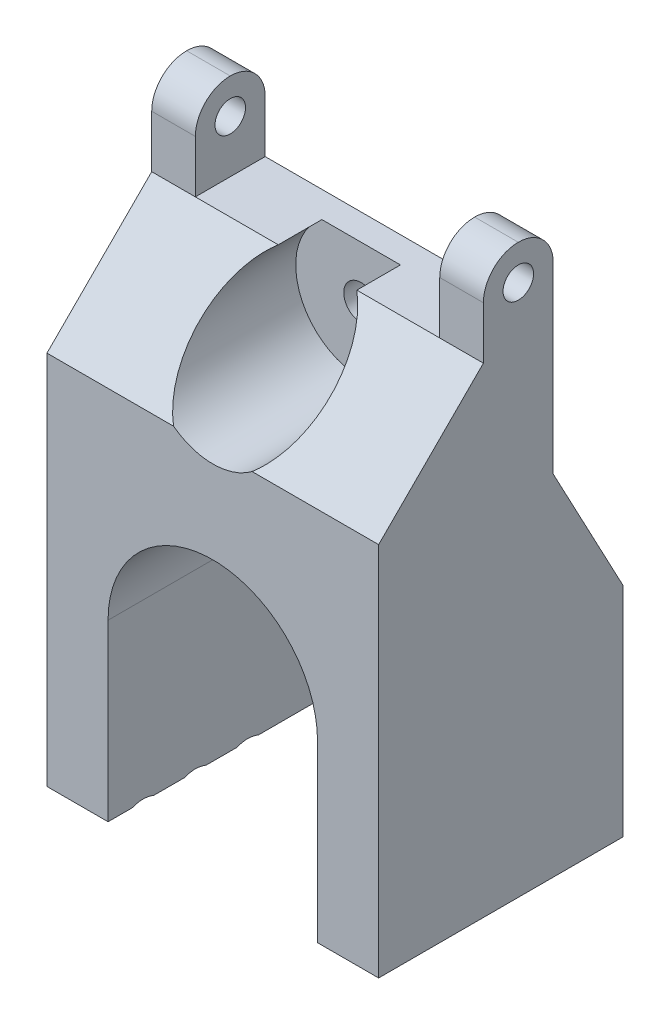
from build123d import *
from OCP.BRepFilletAPI import BRepFilletAPI_MakeChamfer

# Parameters (mm, degrees)
SKETCH1_W               = 38
SKETCH1_H               = 55
BOSS_EXTRUDE1_DEPTH     = 20
CUT_EXTRUDE1_DEPTH      = 39.951893407
SKETCH3_R               = 2.25
CUT_EXTRUDE2_DEPTH      = 20
LPATTERN1_COUNT         = 3
LPATTERN1_PITCH         = 6
CHAMFER1_SIZE           = 12
SKETCH4_W               = 5
SKETCH4_H               = 8
BOSS_EXTRUDE2_DEPTH     = 10
FILLET1_R               = 4
SKETCH5_R               = 1.75
CUT_EXTRUDE3_DEPTH      = 58.010963858
FILLET1_OF_MIRROR1_R    = 4
CHAMFER2_SIZE           = 1
SKETCH6_R               = 7.5
CUT_EXTRUDE4_DEPTH      = 17
CUT_EXTRUDE5_DEPTH      = 46.345892868
CUT_EXTRUDE5_DEPTH_BACK = 46.345892868
SKETCH7_R               = 2
SKETCH8_W               = 7
SKETCH8_H               = 40
BOSS_EXTRUDE3_DEPTH     = 8
CHAMFER3_SIZE           = 15.045811723
CHAMFER3_SIZE_2         = 8


# Some blends are built 0.0001 mm under size
with BuildPart() as part:
    # Sketch1 → Boss-Extrude1 (new body)
    with BuildSketch(Plane.XY):
        Rectangle(SKETCH1_W, SKETCH1_H)
    extrude(amount=BOSS_EXTRUDE1_DEPTH)

    # Sketch2 → Cut-Extrude1 (cut, through all)
    with BuildSketch(Plane.XY.offset(20)):
        with BuildLine():
            Line((-12, -27.5), (12, -27.5))
            Line((12, -27.5), (12, -7.5))
            ThreePointArc((12, -7.5), (0, 4.5), (-12, -7.5))
            Line((-12, -7.5), (-12, -27.5))
        make_face()
    extrude(amount=-CUT_EXTRUDE1_DEPTH, mode=Mode.SUBTRACT)

    # Sketch3 → Cut-Extrude2 (cut)
    with BuildSketch(Plane.XZ.offset(27.5)):
        with Locations(Location((-15, 16, 0), (0, 0, 270))):
            Circle(SKETCH3_R)
        with Locations(Location((15, 16, 0), (0, 0, 270))):
            Circle(SKETCH3_R)
    cut_extrude2 = extrude(amount=-CUT_EXTRUDE2_DEPTH, mode=Mode.SUBTRACT)

    # LPattern1: Cut-Extrude2 ×3
    with Locations(*[(0, 0, -i * LPATTERN1_PITCH) for i in range(1, LPATTERN1_COUNT)]):
        add(cut_extrude2, mode=Mode.SUBTRACT)

    # Chamfer1
    chamfer1_edges = [part.edges().sort_by_distance(p)[0] for p in [
        (0, 27.5, 20),
    ]]
    chamfer(chamfer1_edges, length=CHAMFER1_SIZE)

    # Sketch4 → Boss-Extrude2 (add)
    with BuildSketch(Plane(origin=(0, 27.5, 0), x_dir=(1, 0, 0), z_dir=(0, 1, 0))):
        with Locations((-16.5, -4)):
            Rectangle(SKETCH4_W, SKETCH4_H)
    boss_extrude2 = extrude(amount=BOSS_EXTRUDE2_DEPTH)

    # Fillet1
    fillet1_edges = [part.edges().sort_by_distance(p)[0] for p in [
        (-16.5, 37.5, 0),
        (-16.5, 37.5, 8),
    ]]
    fillet(fillet1_edges, radius=FILLET1_R - 0.0001)  # a hair under: the kernel refuses the full size

    # Sketch5 → Cut-Extrude3 (cut, through all)
    with BuildSketch(Plane.ZY.offset(19)):
        with Locations((4, 33.5)):
            Circle(SKETCH5_R)
    cut_extrude3 = extrude(amount=-CUT_EXTRUDE3_DEPTH, mode=Mode.SUBTRACT)

    # Mirror1: Boss-Extrude2, Cut-Extrude3 across plane
    add(boss_extrude2.mirror(Plane(origin=(0, 0, 0), x_dir=(0, 0, 1), z_dir=(1, 0, 0))))
    add(cut_extrude3.mirror(Plane(origin=(0, 0, 0), x_dir=(0, 0, 1), z_dir=(1, 0, 0))), mode=Mode.SUBTRACT)

    # Fillet1 of Mirror1
    fillet1_of_mirror1_edges = [part.edges().sort_by_distance(p)[0] for p in [
        (16.5, 37.5, 0),
        (16.5, 37.5, 8),
    ]]
    fillet(fillet1_of_mirror1_edges, radius=FILLET1_OF_MIRROR1_R - 0.0001)  # a hair under: the kernel refuses the full size

    # Chamfer2
    # the kernel refuses this chamfer: 1 mm, written as the material it takes off along each edge
    with BuildSketch(Plane(origin=(-15, -27.5, 16), x_dir=(0, 0, -1), z_dir=(-1, 0, 0))) as chamfer2_piece_1:
        Polygon((2.25 + CHAMFER2_SIZE, 0), (2.25, -CHAMFER2_SIZE), (2.25, 0), align=None)
    revolve(axis=Axis((-15, -27.5, 16), (0, -1, 0)), mode=Mode.SUBTRACT)
    with BuildSketch(Plane(origin=(15, -27.5, 16), x_dir=(0, 0, -1), z_dir=(-1, 0, 0))) as chamfer2_piece_2:
        Polygon((2.25 + CHAMFER2_SIZE, 0), (2.25, -CHAMFER2_SIZE), (2.25, 0), align=None)
    revolve(axis=Axis((15, -27.5, 16), (0, -1, 0)), mode=Mode.SUBTRACT)
    with BuildSketch(Plane(origin=(-15, -27.5, 10), x_dir=(0, 0, -1), z_dir=(-1, 0, 0))) as chamfer2_piece_3:
        Polygon((2.25 + CHAMFER2_SIZE, 0), (2.25, -CHAMFER2_SIZE), (2.25, 0), align=None)
    revolve(axis=Axis((-15, -27.5, 10), (0, -1, 0)), mode=Mode.SUBTRACT)
    with BuildSketch(Plane(origin=(-15, -27.5, 4), x_dir=(0, 0, -1), z_dir=(-1, 0, 0))) as chamfer2_piece_4:
        Polygon((2.25 + CHAMFER2_SIZE, 0), (2.25, -CHAMFER2_SIZE), (2.25, 0), align=None)
    revolve(axis=Axis((-15, -27.5, 4), (0, -1, 0)), mode=Mode.SUBTRACT)
    with BuildSketch(Plane(origin=(15, -27.5, 10), x_dir=(0, 0, -1), z_dir=(-1, 0, 0))) as chamfer2_piece_5:
        Polygon((2.25 + CHAMFER2_SIZE, 0), (2.25, -CHAMFER2_SIZE), (2.25, 0), align=None)
    revolve(axis=Axis((15, -27.5, 10), (0, -1, 0)), mode=Mode.SUBTRACT)
    with BuildSketch(Plane(origin=(15, -27.5, 4), x_dir=(0, 0, -1), z_dir=(-1, 0, 0))) as chamfer2_piece_6:
        Polygon((2.25 + CHAMFER2_SIZE, 0), (2.25, -CHAMFER2_SIZE), (2.25, 0), align=None)
    revolve(axis=Axis((15, -27.5, 4), (0, -1, 0)), mode=Mode.SUBTRACT)

    # Sketch6 → Cut-Extrude4 (cut)
    with BuildSketch(Plane.XY.offset(20)):
        with Locations((0, 21.5)):
            Circle(SKETCH6_R)
    extrude(amount=-CUT_EXTRUDE4_DEPTH, mode=Mode.SUBTRACT)

    # Sketch7 → Cut-Extrude5 (cut, two sides: drawn at the far end of the back side and taken through both)
    with BuildSketch(Plane.XY.offset(3).offset(-CUT_EXTRUDE5_DEPTH_BACK)):
        with Locations((0, 21.5)):
            Circle(SKETCH7_R)
    extrude(amount=CUT_EXTRUDE5_DEPTH + CUT_EXTRUDE5_DEPTH_BACK, mode=Mode.SUBTRACT)

    # Sketch8 → Boss-Extrude3 (add)
    with BuildSketch(Plane(origin=(0, 0, 0), x_dir=(-1, 0, 0), z_dir=(0, 0, -1))):
        with Locations((-15.5, -7.5)):
            Rectangle(SKETCH8_W, SKETCH8_H)
        with Locations((15.5, -7.5)):
            Rectangle(SKETCH8_W, SKETCH8_H)
    extrude(amount=BOSS_EXTRUDE3_DEPTH)

    # Chamfer3
    chamfer3_edges_1 = [part.edges().sort_by_distance(p)[0] for p in [
        (-15.5, 12.5, -8),
    ]]
    chamfer3_side_1 = [part.faces().sort_by_distance(p)[0] for p in [
        (-15.5, 12.34, -8),
    ]]
    chamfer3_edges_2 = [part.edges().sort_by_distance(p)[0] for p in [
        (15.5, 12.5, -8),
    ]]
    chamfer3_side_2 = [part.faces().sort_by_distance(p)[0] for p in [
        (15.5, 12.34, -8),
    ]]
    chamfer3 = BRepFilletAPI_MakeChamfer(part.part.solid().wrapped)
    for e in chamfer3_edges_1:
        chamfer3.Add(CHAMFER3_SIZE - 0.0001, CHAMFER3_SIZE_2 - 0.0001, e.wrapped, chamfer3_side_1[0].wrapped)
    for e in chamfer3_edges_2:
        chamfer3.Add(CHAMFER3_SIZE - 0.0001, CHAMFER3_SIZE_2 - 0.0001, e.wrapped, chamfer3_side_2[0].wrapped)
    add(Compound.cast(chamfer3.Shape()), mode=Mode.REPLACE)  # a hair under: the kernel refuses the full size


solid = part.part
